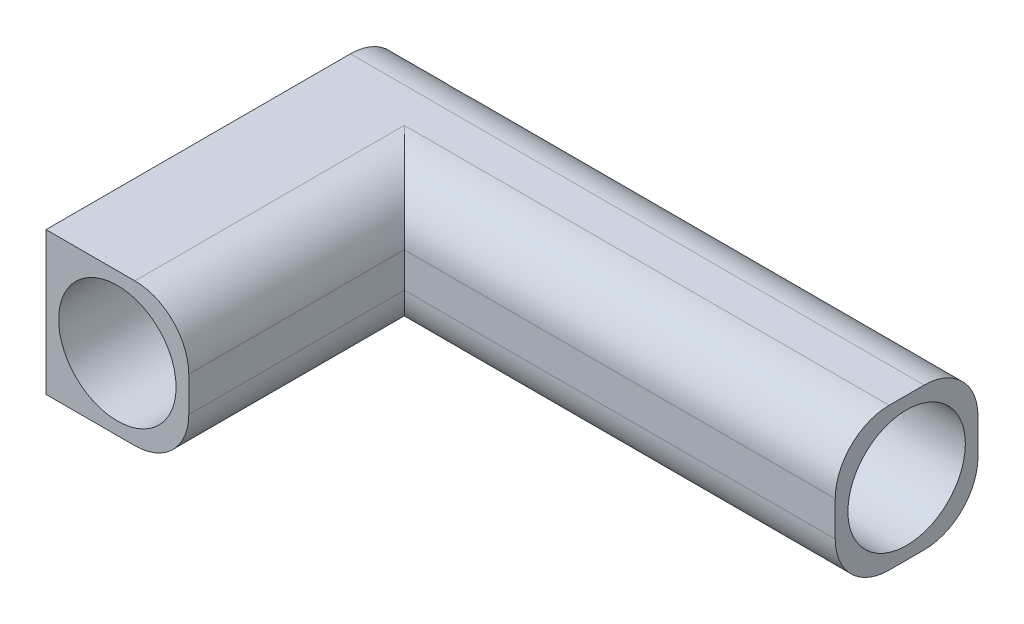
from build123d import *

# Parameters (mm, degrees)
BOSS_EXTRUDE1_DEPTH = 26.5
SKETCH3_R           = 10.9
CUT_EXTRUDE1_DEPTH  = 129.322835068
SKETCH4_R           = 10.9
CUT_EXTRUDE2_DEPTH  = 129.322835068
FILLET1_R           = 10


with BuildPart() as part:
    # Sketch2 → Boss-Extrude1 (new body)
    with BuildSketch(Plane(origin=(0, 0, 0), x_dir=(1, 0, 0), z_dir=(0, 1, 0))):
        Polygon((0, 0), (0, 66.5), (106.5, 66.5), (106.5, 40), (26.5, 40), (26.5, 0), align=None)
    extrude(amount=BOSS_EXTRUDE1_DEPTH)

    # Sketch3 → Cut-Extrude1 (cut, through all)
    with BuildSketch(Plane.XY):
        with Locations((13.25, 13.25)):
            Circle(SKETCH3_R)
    extrude(amount=-CUT_EXTRUDE1_DEPTH, mode=Mode.SUBTRACT)

    # Sketch4 → Cut-Extrude2 (cut, through all)
    with BuildSketch(Plane(origin=(106.5, 0, 0), x_dir=(0, 0, -1), z_dir=(1, 0, 0))):
        with Locations((53.25, 13.25)):
            Circle(SKETCH4_R)
    extrude(amount=-CUT_EXTRUDE2_DEPTH, mode=Mode.SUBTRACT)

    # Fillet1
    # the kernel refuses this fillet: 10 mm, written as the material it takes off along each edge
    with BuildSketch(Plane(origin=(106.5, 26.5, -40), x_dir=(0, 0, -1), z_dir=(-1, 0, 0))) as fillet1_piece_1:
        with BuildLine():
            CenterArc((FILLET1_R, FILLET1_R), FILLET1_R, 180, 90)
            Line((0, FILLET1_R), (-FILLET1_R * 0.02, FILLET1_R))
            Line((-FILLET1_R * 0.02, FILLET1_R), (-FILLET1_R * 0.02, -FILLET1_R * 0.02))
            Line((-FILLET1_R * 0.02, -FILLET1_R * 0.02), (FILLET1_R, -FILLET1_R * 0.02))
            Line((FILLET1_R, -FILLET1_R * 0.02), (FILLET1_R, 0))
        make_face()
    extrude(amount=80, mode=Mode.SUBTRACT)
    with BuildSketch(Plane(origin=(0, 26.5, -66.5), x_dir=(0, 0, 1), z_dir=(1, 0, 0))) as fillet1_piece_2:
        with BuildLine():
            CenterArc((FILLET1_R, FILLET1_R), FILLET1_R, 180, 90)
            Line((0, FILLET1_R), (-FILLET1_R * 0.02, FILLET1_R))
            Line((-FILLET1_R * 0.02, FILLET1_R), (-FILLET1_R * 0.02, -FILLET1_R * 0.02))
            Line((-FILLET1_R * 0.02, -FILLET1_R * 0.02), (FILLET1_R, -FILLET1_R * 0.02))
            Line((FILLET1_R, -FILLET1_R * 0.02), (FILLET1_R, 0))
        make_face()
    extrude(amount=106.5, mode=Mode.SUBTRACT)
    with BuildSketch(Plane(origin=(0, 0, -66.5), x_dir=(0, 0, 1), z_dir=(1, 0, 0))) as fillet1_piece_3:
        with BuildLine():
            CenterArc((FILLET1_R, -FILLET1_R), FILLET1_R, 90, 90)
            Line((0, -FILLET1_R), (-FILLET1_R * 0.02, -FILLET1_R))
            Line((-FILLET1_R * 0.02, -FILLET1_R), (-FILLET1_R * 0.02, FILLET1_R * 0.02))
            Line((-FILLET1_R * 0.02, FILLET1_R * 0.02), (FILLET1_R, FILLET1_R * 0.02))
            Line((FILLET1_R, FILLET1_R * 0.02), (FILLET1_R, 0))
        make_face()
    extrude(amount=106.5, mode=Mode.SUBTRACT)
    with BuildSketch(Plane(origin=(106.5, 0, -40), x_dir=(0, 0, -1), z_dir=(-1, 0, 0))) as fillet1_piece_4:
        with BuildLine():
            CenterArc((FILLET1_R, -FILLET1_R), FILLET1_R, 90, 90)
            Line((0, -FILLET1_R), (-FILLET1_R * 0.02, -FILLET1_R))
            Line((-FILLET1_R * 0.02, -FILLET1_R), (-FILLET1_R * 0.02, FILLET1_R * 0.02))
            Line((-FILLET1_R * 0.02, FILLET1_R * 0.02), (FILLET1_R, FILLET1_R * 0.02))
            Line((FILLET1_R, FILLET1_R * 0.02), (FILLET1_R, 0))
        make_face()
    extrude(amount=80, mode=Mode.SUBTRACT)
    with BuildSketch(Plane(origin=(26.5, 0, -40), x_dir=(-1, 0, 0), z_dir=(0, 0, 1))) as fillet1_piece_5:
        with BuildLine():
            CenterArc((FILLET1_R, -FILLET1_R), FILLET1_R, 90, 90)
            Line((0, -FILLET1_R), (-FILLET1_R * 0.02, -FILLET1_R))
            Line((-FILLET1_R * 0.02, -FILLET1_R), (-FILLET1_R * 0.02, FILLET1_R * 0.02))
            Line((-FILLET1_R * 0.02, FILLET1_R * 0.02), (FILLET1_R, FILLET1_R * 0.02))
            Line((FILLET1_R, FILLET1_R * 0.02), (FILLET1_R, 0))
        make_face()
    extrude(amount=40, mode=Mode.SUBTRACT)
    with BuildSketch(Plane(origin=(26.5, 26.5, -40), x_dir=(-1, 0, 0), z_dir=(0, 0, 1))) as fillet1_piece_6:
        with BuildLine():
            CenterArc((FILLET1_R, FILLET1_R), FILLET1_R, 180, 90)
            Line((0, FILLET1_R), (-FILLET1_R * 0.02, FILLET1_R))
            Line((-FILLET1_R * 0.02, FILLET1_R), (-FILLET1_R * 0.02, -FILLET1_R * 0.02))
            Line((-FILLET1_R * 0.02, -FILLET1_R * 0.02), (FILLET1_R, -FILLET1_R * 0.02))
            Line((FILLET1_R, -FILLET1_R * 0.02), (FILLET1_R, 0))
        make_face()
    extrude(amount=40, mode=Mode.SUBTRACT)
    with BuildSketch(Plane(origin=(106.5, 26.5, -40), x_dir=(0, 0, -1), z_dir=(-1, 0, 0))) as fillet1_piece_7a_section:
        with BuildLine():
            CenterArc((FILLET1_R, FILLET1_R), FILLET1_R, 180, 90)
            Line((0, FILLET1_R), (-FILLET1_R * 0.02, FILLET1_R))
            Line((-FILLET1_R * 0.02, FILLET1_R), (-FILLET1_R * 0.02, -FILLET1_R * 0.02))
            Line((-FILLET1_R * 0.02, -FILLET1_R * 0.02), (FILLET1_R, -FILLET1_R * 0.02))
            Line((FILLET1_R, -FILLET1_R * 0.02), (FILLET1_R, 0))
        make_face()
    fillet1_piece_7a = extrude(amount=105, mode=Mode.PRIVATE)
    fillet1_piece_7a = split(fillet1_piece_7a, bisect_by=Plane(origin=(26.5, 24.236048857, -42.263951143), z_dir=(-1, 0, 0)), keep=Keep.TOP, mode=Mode.PRIVATE)
    with BuildSketch(Plane(origin=(26.5, 26.5, -65), x_dir=(-1, 0, 0), z_dir=(0, 0, 1))) as fillet1_piece_7b_section:
        with BuildLine():
            CenterArc((FILLET1_R, FILLET1_R), FILLET1_R, 180, 90)
            Line((0, FILLET1_R), (-FILLET1_R * 0.02, FILLET1_R))
            Line((-FILLET1_R * 0.02, FILLET1_R), (-FILLET1_R * 0.02, -FILLET1_R * 0.02))
            Line((-FILLET1_R * 0.02, -FILLET1_R * 0.02), (FILLET1_R, -FILLET1_R * 0.02))
            Line((FILLET1_R, -FILLET1_R * 0.02), (FILLET1_R, 0))
        make_face()
    fillet1_piece_7b = extrude(amount=65, mode=Mode.PRIVATE)
    fillet1_piece_7b = split(fillet1_piece_7b, bisect_by=Plane(origin=(24.236048857, 24.236048857, -40), z_dir=(0, 0, -1)), keep=Keep.TOP, mode=Mode.PRIVATE)
    fillet1_piece_7 = fillet1_piece_7a & fillet1_piece_7b
    add(fillet1_piece_7, mode=Mode.SUBTRACT)
    with BuildSketch(Plane(origin=(106.5, 0, -40), x_dir=(0, 0, -1), z_dir=(-1, 0, 0))) as fillet1_piece_8a_section:
        with BuildLine():
            CenterArc((FILLET1_R, -FILLET1_R), FILLET1_R, 90, 90)
            Line((0, -FILLET1_R), (-FILLET1_R * 0.02, -FILLET1_R))
            Line((-FILLET1_R * 0.02, -FILLET1_R), (-FILLET1_R * 0.02, FILLET1_R * 0.02))
            Line((-FILLET1_R * 0.02, FILLET1_R * 0.02), (FILLET1_R, FILLET1_R * 0.02))
            Line((FILLET1_R, FILLET1_R * 0.02), (FILLET1_R, 0))
        make_face()
    fillet1_piece_8a = extrude(amount=105, mode=Mode.PRIVATE)
    fillet1_piece_8a = split(fillet1_piece_8a, bisect_by=Plane(origin=(26.5, 2.263951143, -42.263951143), z_dir=(-1, 0, 0)), keep=Keep.TOP, mode=Mode.PRIVATE)
    with BuildSketch(Plane(origin=(26.5, 0, -65), x_dir=(-1, 0, 0), z_dir=(0, 0, 1))) as fillet1_piece_8b_section:
        with BuildLine():
            CenterArc((FILLET1_R, -FILLET1_R), FILLET1_R, 90, 90)
            Line((0, -FILLET1_R), (-FILLET1_R * 0.02, -FILLET1_R))
            Line((-FILLET1_R * 0.02, -FILLET1_R), (-FILLET1_R * 0.02, FILLET1_R * 0.02))
            Line((-FILLET1_R * 0.02, FILLET1_R * 0.02), (FILLET1_R, FILLET1_R * 0.02))
            Line((FILLET1_R, FILLET1_R * 0.02), (FILLET1_R, 0))
        make_face()
    fillet1_piece_8b = extrude(amount=65, mode=Mode.PRIVATE)
    fillet1_piece_8b = split(fillet1_piece_8b, bisect_by=Plane(origin=(24.236048857, 2.263951143, -40), z_dir=(0, 0, -1)), keep=Keep.TOP, mode=Mode.PRIVATE)
    fillet1_piece_8 = fillet1_piece_8a & fillet1_piece_8b
    add(fillet1_piece_8, mode=Mode.SUBTRACT)


solid = part.part
